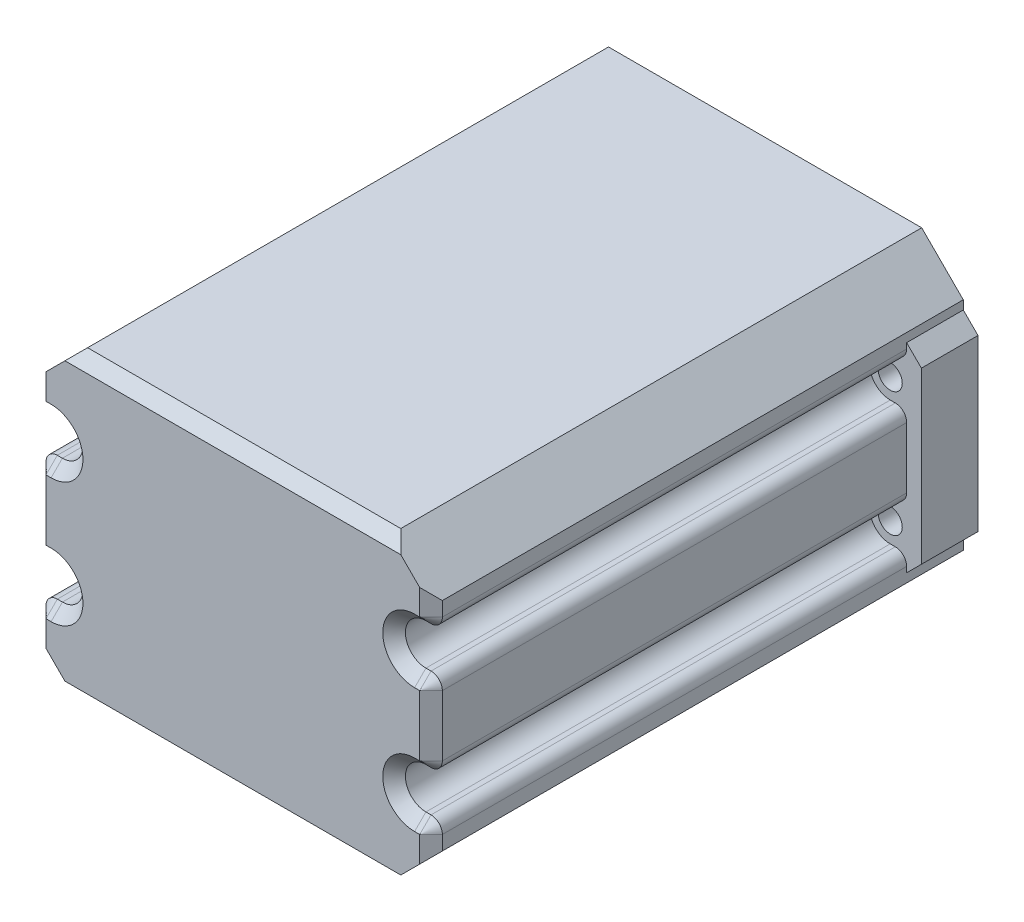
from build123d import *

# Parameters (mm, degrees)
BOSS_EXTRUDE1_DEPTH = 90
SKETCH1_3_R         = 2.125
BOSS_EXTRUDE2_DEPTH = 10
FILLET1_R           = 2
BOSS_EXTRUDE3_START = 4
BOSS_EXTRUDE3_DEPTH = 4
CHAMFER1_SIZE       = 2
CUT_EXTRUDE1_DEPTH  = 1.7
FILLET2_R           = 2


# Some blends are built 0.0001 mm under size
with BuildPart() as part:
    # Sketch1 → Boss-Extrude1 (new body)
    with BuildSketch(Plane.XY):
        with BuildLine():
            Line((55.313708499, 53), (0, 53))
            Line((0, 53), (-7.343145751, 45.656854249))
            Line((-7.343145751, 45.656854249), (-7.343145751, 41.125))
            Line((-7.343145751, 41.125), (-4.443145751, 41.125))
            ThreePointArc((-4.443145751, 41.125), (-0.818145751, 37.5), (-4.443145751, 33.875))
            Line((-4.443145751, 33.875), (-7.343145751, 33.875))
            Line((-7.343145751, 33.875), (-7.343145751, 19.125))
            Line((-7.343145751, 19.125), (-4.443145751, 19.125))
            ThreePointArc((-4.443145751, 19.125), (-0.818145751, 15.5), (-4.443145751, 11.875))
            Line((-4.443145751, 11.875), (-7.343145751, 11.875))
            Line((-7.343145751, 11.875), (-7.343145751, 7.343145751))
            Line((-7.343145751, 7.343145751), (0, 0))
            Line((0, 0), (55.313708499, 0))
            Line((55.313708499, 0), (62.656854249, 7.343145751))
            Line((62.656854249, 7.343145751), (62.656854249, 11.875))
            Line((62.656854249, 11.875), (59.756854249, 11.875))
            ThreePointArc((59.756854249, 11.875), (56.131854249, 15.5), (59.756854249, 19.125))
            Line((59.756854249, 19.125), (62.656854249, 19.125))
            Line((62.656854249, 19.125), (62.656854249, 33.875))
            Line((62.656854249, 33.875), (59.756854249, 33.875))
            ThreePointArc((59.756854249, 33.875), (56.131854249, 37.5), (59.756854249, 41.125))
            Line((59.756854249, 41.125), (62.656854249, 41.125))
            Line((62.656854249, 41.125), (62.656854249, 45.656854249))
            Line((62.656854249, 45.656854249), (55.313708499, 53))
        make_face()
        with BuildLine():
            Line((53.656854249, 4), (1.656854249, 4))
            Line((1.656854249, 4), (-3.343145751, 9))
            Line((-3.343145751, 9), (-3.343145751, 9.601695159))
            ThreePointArc((-3.343145751, 9.601695159), (0.172046553, 11.665942097), (1.556854249, 15.5))
            Line((1.556854249, 15.5), (1.556854249, 37.5))
            ThreePointArc((1.556854249, 37.5), (0.172046553, 41.334057903), (-3.343145751, 43.398304841))
            Line((-3.343145751, 43.398304841), (-3.343145751, 44))
            Line((-3.343145751, 44), (1.656854249, 49))
            Line((1.656854249, 49), (53.656854249, 49))
            Line((53.656854249, 49), (58.656854249, 44))
            Line((58.656854249, 44), (58.656854249, 43.398304841))
            ThreePointArc((58.656854249, 43.398304841), (55.141661946, 41.334057903), (53.756854249, 37.5))
            Line((53.756854249, 37.5), (53.756854249, 15.5))
            ThreePointArc((53.756854249, 15.5), (55.141661946, 11.665942097), (58.656854249, 9.601695159))
            Line((58.656854249, 9.601695159), (58.656854249, 9))
            Line((58.656854249, 9), (53.656854249, 4))
        make_face(mode=Mode.SUBTRACT)
    extrude(amount=BOSS_EXTRUDE1_DEPTH)

    # Sketch1<3> → Boss-Extrude2 (add)
    # profile 1 of 2: a face of its own
    with BuildSketch(Plane.XY):
        with BuildLine():
            ThreePointArc((-4.443145751, 33.875), (-0.818145751, 37.5), (-4.443145751, 41.125))
            Line((-4.443145751, 41.125), (-7.343145751, 41.125))
            Line((-7.343145751, 41.125), (-7.343145751, 44.1))
            Line((-7.343145751, 44.1), (-9.943145751, 41.5))
            Line((-9.943145751, 41.5), (-9.943145751, 11.5))
            Line((-9.943145751, 11.5), (-7.343145751, 8.9))
            Line((-7.343145751, 8.9), (-7.343145751, 11.875))
            Line((-7.343145751, 11.875), (-4.443145751, 11.875))
            ThreePointArc((-4.443145751, 11.875), (-0.818145751, 15.5), (-4.443145751, 19.125))
            Line((-4.443145751, 19.125), (-7.343145751, 19.125))
            Line((-7.343145751, 19.125), (-7.343145751, 33.875))
            Line((-7.343145751, 33.875), (-4.443145751, 33.875))
        make_face()
        with Locations((-4.443145751, 15.5)):
            Circle(SKETCH1_3_R, mode=Mode.SUBTRACT)
        with Locations((-4.443145751, 37.5)):
            Circle(SKETCH1_3_R, mode=Mode.SUBTRACT)
    # profile 2 of 2: a face of its own
    with BuildSketch(Plane.XY):
        with BuildLine():
            Line((65.256854249, 41.5), (62.656854249, 44.1))
            Line((62.656854249, 44.1), (62.656854249, 41.125))
            Line((62.656854249, 41.125), (59.756854249, 41.125))
            ThreePointArc((59.756854249, 41.125), (56.131854249, 37.5), (59.756854249, 33.875))
            Line((59.756854249, 33.875), (62.656854249, 33.875))
            Line((62.656854249, 33.875), (62.656854249, 19.125))
            Line((62.656854249, 19.125), (59.756854249, 19.125))
            ThreePointArc((59.756854249, 19.125), (56.131854249, 15.5), (59.756854249, 11.875))
            Line((59.756854249, 11.875), (62.656854249, 11.875))
            Line((62.656854249, 11.875), (62.656854249, 8.9))
            Line((62.656854249, 8.9), (65.256854249, 11.5))
            Line((65.256854249, 11.5), (65.256854249, 41.5))
        make_face()
        with Locations((59.756854249, 37.5)):
            Circle(SKETCH1_3_R, mode=Mode.SUBTRACT)
        with Locations((59.756854249, 15.5)):
            Circle(SKETCH1_3_R, mode=Mode.SUBTRACT)
    extrude(amount=BOSS_EXTRUDE2_DEPTH)

    # Fillet1
    fillet1_edges = [part.edges().sort_by_distance(p)[0] for p in [
        (62.656854249, 41.125, 50),
        (62.656854249, 33.875, 50),
        (62.656854249, 19.125, 50),
        (62.656854249, 11.875, 50),
        (-7.343145751, 11.875, 50),
        (-7.343145751, 19.125, 50),
        (-7.343145751, 33.875, 50),
        (-7.343145751, 41.125, 50),
    ]]
    fillet(fillet1_edges, radius=FILLET1_R)

    # Sketch2 → Boss-Extrude3 (add)
    with BuildSketch(Plane.XY.offset(90).offset(BOSS_EXTRUDE3_START)):
        with BuildLine():
            Line((-7.343145751, 31.875), (-7.343145751, 21.125))
            ThreePointArc((-7.343145751, 21.125), (-6.757359313, 19.710786438), (-5.343145751, 19.125))
            Line((-5.343145751, 19.125), (-4.443145751, 19.125))
            ThreePointArc((-4.443145751, 19.125), (-0.818145751, 15.5), (-4.443145751, 11.875))
            Line((-4.443145751, 11.875), (-5.343145751, 11.875))
            ThreePointArc((-5.343145751, 11.875), (-6.757359313, 11.289213562), (-7.343145751, 9.875))
            Line((-7.343145751, 9.875), (-7.343145751, 7.343145751))
            Line((-7.343145751, 7.343145751), (0, 0))
            Line((0, 0), (55.313708499, 0))
            Line((55.313708499, 0), (62.656854249, 7.343145751))
            Line((62.656854249, 7.343145751), (62.656854249, 9.875))
            ThreePointArc((62.656854249, 9.875), (62.071067812, 11.289213562), (60.656854249, 11.875))
            Line((60.656854249, 11.875), (59.756854249, 11.875))
            ThreePointArc((59.756854249, 11.875), (56.131854249, 15.5), (59.756854249, 19.125))
            Line((59.756854249, 19.125), (60.656854249, 19.125))
            ThreePointArc((60.656854249, 19.125), (62.071067812, 19.710786438), (62.656854249, 21.125))
            Line((62.656854249, 21.125), (62.656854249, 31.875))
            ThreePointArc((62.656854249, 31.875), (62.071067812, 33.289213562), (60.656854249, 33.875))
            Line((60.656854249, 33.875), (59.756854249, 33.875))
            ThreePointArc((59.756854249, 33.875), (56.131854249, 37.5), (59.756854249, 41.125))
            Line((59.756854249, 41.125), (60.656854249, 41.125))
            ThreePointArc((60.656854249, 41.125), (62.071067812, 41.710786438), (62.656854249, 43.125))
            Line((62.656854249, 43.125), (62.656854249, 45.656854249))
            Line((62.656854249, 45.656854249), (55.313708499, 53))
            Line((55.313708499, 53), (0, 53))
            Line((0, 53), (-7.343145751, 45.656854249))
            Line((-7.343145751, 45.656854249), (-7.343145751, 43.125))
            ThreePointArc((-7.343145751, 43.125), (-6.757359313, 41.710786438), (-5.343145751, 41.125))
            Line((-5.343145751, 41.125), (-4.443145751, 41.125))
            ThreePointArc((-4.443145751, 41.125), (-0.818145751, 37.5), (-4.443145751, 33.875))
            Line((-4.443145751, 33.875), (-5.343145751, 33.875))
            ThreePointArc((-5.343145751, 33.875), (-6.757359313, 33.289213562), (-7.343145751, 31.875))
        make_face()
    extrude(amount=-BOSS_EXTRUDE3_DEPTH)

    # Chamfer1
    chamfer1_edges = [part.edges().sort_by_distance(p)[0] for p in [
        (-7.343145751, 44.390927125, 94),
        (-6.757359313, 41.710786438, 94),
        (-4.893145751, 41.125, 94),
        (-0.818145751, 37.5, 94),
        (-4.893145751, 33.875, 94),
        (-6.757359313, 33.289213562, 94),
        (-7.343145751, 26.5, 94),
        (-6.757359313, 19.710786438, 94),
        (-4.893145751, 19.125, 94),
        (-0.818145751, 15.5, 94),
        (-4.893145751, 11.875, 94),
        (-6.757359313, 11.289213562, 94),
        (-7.343145751, 8.609072875, 94),
        (27.656854249, 0, 94),
        (62.656854249, 8.609072875, 94),
        (62.071067812, 11.289213562, 94),
        (60.206854249, 11.875, 94),
        (56.131854249, 15.5, 94),
        (60.206854249, 19.125, 94),
        (62.071067812, 19.710786438, 94),
        (62.656854249, 26.5, 94),
        (62.071067812, 33.289213562, 94),
        (60.206854249, 33.875, 94),
        (56.131854249, 37.5, 94),
        (60.206854249, 41.125, 94),
        (62.071067812, 41.710786438, 94),
        (62.656854249, 44.390927125, 94),
        (27.656854249, 53, 94),
    ]]
    chamfer(chamfer1_edges, length=CHAMFER1_SIZE - 0.0001)  # a hair under: the kernel refuses the full size

    # Sketch3 → Cut-Extrude1 (cut)
    with BuildSketch(Plane(origin=(0, 0, 0), x_dir=(-1, 0, 0), z_dir=(0, 0, -1))):
        with BuildLine():
            ThreePointArc((6.343145751, 39.821637353), (3.158622493, 40.211088342), (1.443145751, 37.5))
            Line((1.443145751, 37.5), (1.443145751, 15.5))
            ThreePointArc((1.443145751, 15.5), (3.158622493, 12.788911658), (6.343145751, 13.178362647))
            Line((6.343145751, 13.178362647), (6.343145751, 7.757359313))
            Line((6.343145751, 7.757359313), (-0.414213562, 1))
            Line((-0.414213562, 1), (-54.899494937, 1))
            Line((-54.899494937, 1), (-61.656854249, 7.757359313))
            Line((-61.656854249, 7.757359313), (-61.656854249, 13.178362647))
            ThreePointArc((-61.656854249, 13.178362647), (-58.472330992, 12.788911658), (-56.756854249, 15.5))
            Line((-56.756854249, 15.5), (-56.756854249, 37.5))
            ThreePointArc((-56.756854249, 37.5), (-58.472330992, 40.211088342), (-61.656854249, 39.821637353))
            Line((-61.656854249, 39.821637353), (-61.656854249, 45.242640687))
            Line((-61.656854249, 45.242640687), (-54.899494937, 52))
            Line((-54.899494937, 52), (-0.414213562, 52))
            Line((-0.414213562, 52), (6.343145751, 45.242640687))
            Line((6.343145751, 45.242640687), (6.343145751, 39.821637353))
        make_face()
        with BuildLine():
            Line((4.343145751, 42.4989999), (4.343145751, 44.414213562))
            Line((4.343145751, 44.414213562), (-1.242640687, 50))
            Line((-1.242640687, 50), (-54.071067812, 50))
            Line((-54.071067812, 50), (-59.656854249, 44.414213562))
            Line((-59.656854249, 44.414213562), (-59.656854249, 42.4989999))
            ThreePointArc((-59.656854249, 42.4989999), (-56.186140035, 41), (-54.756854249, 37.5))
            Line((-54.756854249, 37.5), (-54.756854249, 15.5))
            ThreePointArc((-54.756854249, 15.5), (-56.186140035, 12), (-59.656854249, 10.5010001))
            Line((-59.656854249, 10.5010001), (-59.656854249, 8.585786438))
            Line((-59.656854249, 8.585786438), (-54.071067812, 3))
            Line((-54.071067812, 3), (-1.242640687, 3))
            Line((-1.242640687, 3), (4.343145751, 8.585786438))
            Line((4.343145751, 8.585786438), (4.343145751, 10.5010001))
            ThreePointArc((4.343145751, 10.5010001), (0.872431536, 12), (-0.556854249, 15.5))
            Line((-0.556854249, 15.5), (-0.556854249, 37.5))
            ThreePointArc((-0.556854249, 37.5), (0.872431536, 41), (4.343145751, 42.4989999))
        make_face(mode=Mode.SUBTRACT)
    extrude(amount=-CUT_EXTRUDE1_DEPTH, mode=Mode.SUBTRACT)

    # Fillet2
    # the kernel refuses this fillet: 2 mm, written as the material it takes off along each edge
    with BuildSketch(Plane(origin=(1.242640687, 3, -2.071067812), x_dir=(1, 0, 0), z_dir=(0, 0, 1)), Plane(origin=(-4.343145751, 8.585786438, -2.071067812), x_dir=(0.7071067811865465, -0.7071067811865486, 0), z_dir=(0, 0, 1)), Plane(origin=(-4.343145751, 44.414213562, -2.071067812), x_dir=(0, -1, 0), z_dir=(0, 0, 1)), Plane(origin=(1.242640687, 50, -2.071067812), x_dir=(-0.7071067811865446, -0.7071067811865505, 0), z_dir=(0, 0, 1)), Plane(origin=(54.071067812, 50, -2.071067812), x_dir=(-1, 0, 0), z_dir=(0, 0, 1)), Plane(origin=(59.656854249, 44.414213562, -2.071067812), x_dir=(-0.7071067811865476, 0.7071067811865476, 0), z_dir=(0, 0, 1)), Plane(origin=(54.071067812, 3, -2.071067812), x_dir=(0.7071067811865448, 0.7071067811865502, 0), z_dir=(0, 0, 1)), Plane(origin=(59.656854249, 8.585786438, -2.071067812), x_dir=(0, 1, 0), z_dir=(0, 0, 1))) as fillet2_piece_1:
        with BuildLine():
            CenterArc((FILLET2_R * 0.414213562373, FILLET2_R), FILLET2_R, 225, 45)
            Line((-FILLET2_R * 0.292893218813, FILLET2_R * 0.292893218813), (0, 0))
            Line((0, 0), (FILLET2_R * 0.414213562373, 0))
        make_face()
    extrude(amount=3.771067812, mode=Mode.SUBTRACT)
    with BuildSketch(Plane(origin=(-4.343145751, 10.5010001, -4.196436275), x_dir=(0, -1, 0), z_dir=(0, 0, 1)), Plane(origin=(59.656854249, 42.4989999, -4.196436275), x_dir=(0, 1, 0), z_dir=(0, 0, 1))) as fillet2_piece_2:
        with BuildLine():
            CenterArc((1.67857451, 2), FILLET2_R, 197.457603124, 72.542396876)
            ThreePointArc((-0.229303893, 1.4), (-0.064746671, 0.70817391), (0, 0))
            Line((0, 0), (1.67857451, 0))
        make_face()
    extrude(amount=5.896436275, mode=Mode.SUBTRACT)
    with BuildSketch(Plane(origin=(-4.343145751, 42.4989999, -4.196436275), x_dir=(0.9868506458664519, -0.16163478200240997, 0), z_dir=(0, 0, 1)), Plane(origin=(59.656854249, 10.5010001, -4.196436275), x_dir=(-0.9868506458664523, 0.16163478200240763, 0), z_dir=(0, 0, 1))) as fillet2_piece_3:
        with BuildLine():
            CenterArc((1.702385267, 1.979771903), FILLET2_R, 189.301797561, 72.542396876)
            Line((-0.271316025, 1.656502339), (0, 0))
            ThreePointArc((0, 0), (0.709327194, 0.050570242), (1.418654389, 0))
        make_face()
    extrude(amount=5.896436275, mode=Mode.SUBTRACT)


solid = part.part
